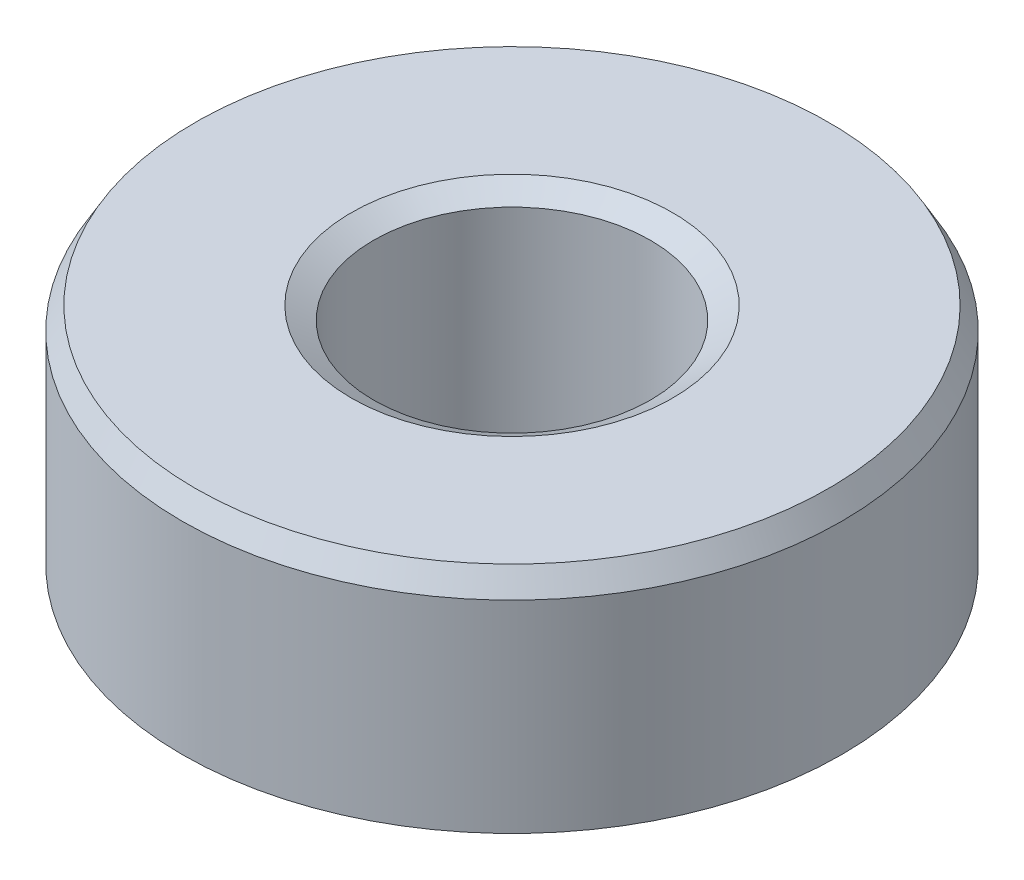
from build123d import *
from OCP.BRepFilletAPI import BRepFilletAPI_MakeChamfer

# Parameters (mm, degrees)
SKETCH1_R           = 50
BOSS_EXTRUDE1_DEPTH = 35.954805004
SKETCH2_R           = 20.999156314
CUT_EXTRUDE1_DEPTH  = 80.32684289
CHAMFER1_SIZE       = 3.365478358
CHAMFER1_SIZE2      = 1.943059836


with BuildPart() as part:
    # Sketch1 → Boss-Extrude1 (new body)
    with BuildSketch(Plane(origin=(0, 0, 0), x_dir=(1, 0, 0), z_dir=(0, 1, 0))):
        Circle(SKETCH1_R)
    extrude(amount=BOSS_EXTRUDE1_DEPTH)

    # Sketch2 → Cut-Extrude1 (cut, through all)
    with BuildSketch(Plane(origin=(0, 0, 0), x_dir=(1, 0, 0), z_dir=(0, 1, 0))):
        Circle(SKETCH2_R)
    extrude(amount=CUT_EXTRUDE1_DEPTH, mode=Mode.SUBTRACT)

    # Chamfer1: one chamfer whose edges measure the first distance from different faces: ONE call of the kernel's chamfer builder (chamfer() names one face for all edges)
    chamfer1_edges_1 = [part.edges().sort_by_distance(p)[0] for p in [
        (-20.999156314, 35.954805004, 0),
    ]]
    chamfer1_side_1 = [part.faces().sort_by_distance(p)[0] for p in [
        (-48.585786438, 35.954805004, 0),
    ]]
    chamfer1_edges_2 = [part.edges().sort_by_distance(p)[0] for p in [
        (-20.999156314, 0, 0),
    ]]
    chamfer1_side_2 = [part.faces().sort_by_distance(p)[0] for p in [
        (-20.999156314, 17.977402502, 0),
    ]]
    chamfer1_edges_3 = [part.edges().sort_by_distance(p)[0] for p in [
        (-50, 0, 0),
    ]]
    chamfer1_side_3 = [part.faces().sort_by_distance(p)[0] for p in [
        (-48.585786438, 0, 0),
    ]]
    chamfer1_edges_4 = [part.edges().sort_by_distance(p)[0] for p in [
        (-50, 35.954805004, 0),
    ]]
    chamfer1_side_4 = [part.faces().sort_by_distance(p)[0] for p in [
        (-50, 17.977402502, 0),
    ]]
    chamfer1 = BRepFilletAPI_MakeChamfer(part.part.solid().wrapped)
    for e in chamfer1_edges_1:
        chamfer1.Add(CHAMFER1_SIZE, CHAMFER1_SIZE2, e.wrapped, chamfer1_side_1[0].wrapped)  # the first distance lies on this face
    for e in chamfer1_edges_2:
        chamfer1.Add(CHAMFER1_SIZE, CHAMFER1_SIZE2, e.wrapped, chamfer1_side_2[0].wrapped)  # the first distance lies on this face
    for e in chamfer1_edges_3:
        chamfer1.Add(CHAMFER1_SIZE, CHAMFER1_SIZE2, e.wrapped, chamfer1_side_3[0].wrapped)  # the first distance lies on this face
    for e in chamfer1_edges_4:
        chamfer1.Add(CHAMFER1_SIZE, CHAMFER1_SIZE2, e.wrapped, chamfer1_side_4[0].wrapped)  # the first distance lies on this face
    add(Compound.cast(chamfer1.Shape()), mode=Mode.REPLACE)


solid = part.part
